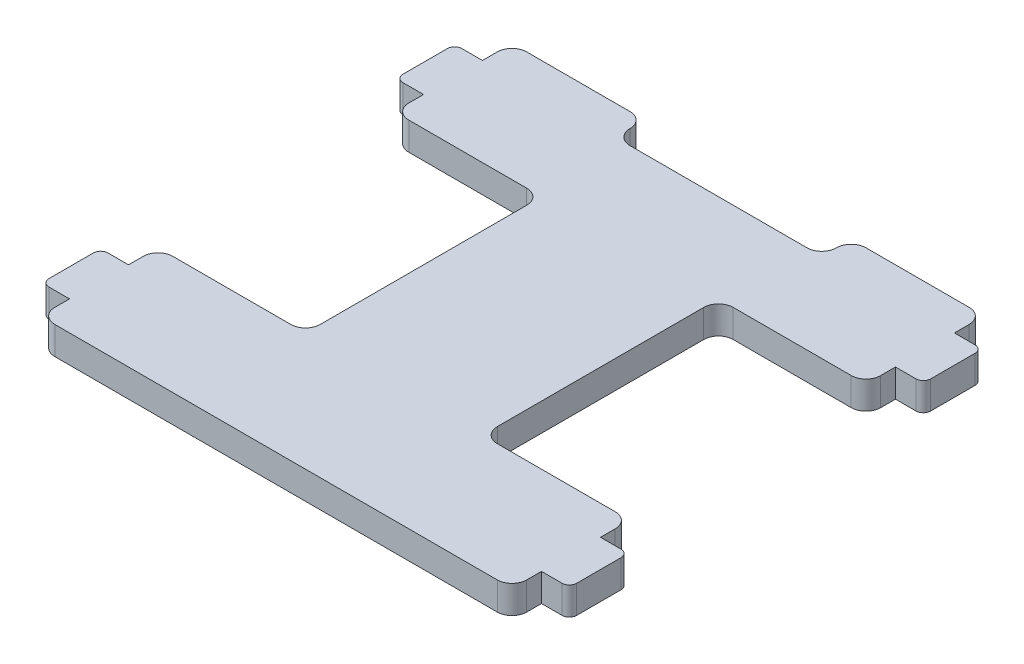
from build123d import *

# Parameters (mm, degrees)
BOSS_EXTRUDE1_DEPTH = 1.5
FILLET1_R           = 1.5875
SKETCH2_W           = 3
SKETCH2_H           = 6.35
BOSS_EXTRUDE2_DEPTH = 3
FILLET2_R           = 0.79375


with BuildPart() as part:
    # Sketch1 → Boss-Extrude1 (new, symmetric)
    with BuildSketch(Plane(origin=(0, 0, 0), x_dir=(1, 0, 0), z_dir=(0, 1, 0))):
        Polygon((25.4, 12.7), (9.525, 12.7), (9.525, -12.7), (25.4, -12.7), (25.4, -25.4), (9.525, -25.4), (0, -25.4), (-9.525, -25.4), (-25.4, -25.4), (-25.4, -12.7), (-9.525, -12.7), (-9.525, 12.7), (-25.4, 12.7), (-25.4, 25.4), (-11.1125, 25.4), (-11.1125, 22.225), (11.1125, 22.225), (11.1125, 25.4), (25.4, 25.4), align=None)
    extrude(amount=BOSS_EXTRUDE1_DEPTH, both=True)

    # Fillet1
    fillet1_edges = [part.edges().sort_by_distance(p)[0] for p in [
        (25.4, 0, -12.7),
        (9.525, 0, -12.7),
        (9.525, 0, 12.7),
        (25.4, 0, 12.7),
        (25.4, 0, 25.4),
        (-25.4, 0, 12.7),
        (-9.525, 0, 12.7),
        (-9.525, 0, -12.7),
        (-25.4, 0, -12.7),
        (-25.4, 0, -25.4),
        (-25.4, 0, 25.4),
        (25.4, 0, -25.4),
        (-11.1125, 0, -25.4),
        (-11.1125, 0, -22.225),
        (11.1125, 0, -22.225),
        (11.1125, 0, -25.4),
    ]]
    fillet(fillet1_edges, radius=FILLET1_R - 0.0001)  # a hair under: the kernel refuses the full size

    # Sketch2 → Boss-Extrude2 (add)
    with BuildSketch(Plane(origin=(0, 1.5, 0), x_dir=(1, 0, 0), z_dir=(0, 1, 0))):
        with Locations((-26.9, 19.05)):
            Rectangle(SKETCH2_W, SKETCH2_H)
        with Locations((26.9, 19.05)):
            Rectangle(SKETCH2_W, SKETCH2_H)
        with Locations((26.9, -19.05)):
            Rectangle(SKETCH2_W, SKETCH2_H)
        with Locations((-26.9, -19.05)):
            Rectangle(SKETCH2_W, SKETCH2_H)
    extrude(amount=-BOSS_EXTRUDE2_DEPTH)

    # Fillet2
    fillet2_edges = [part.edges().sort_by_distance(p)[0] for p in [
        (-28.4, 0, 22.225),
        (-28.4, 0, 15.875),
        (28.4, 0, 15.875),
        (28.4, 0, 22.225),
        (28.4, 0, -22.225),
        (28.4, 0, -15.875),
        (-28.4, 0, -15.875),
        (-28.4, 0, -22.225),
    ]]
    fillet(fillet2_edges, radius=FILLET2_R)


solid = part.part
